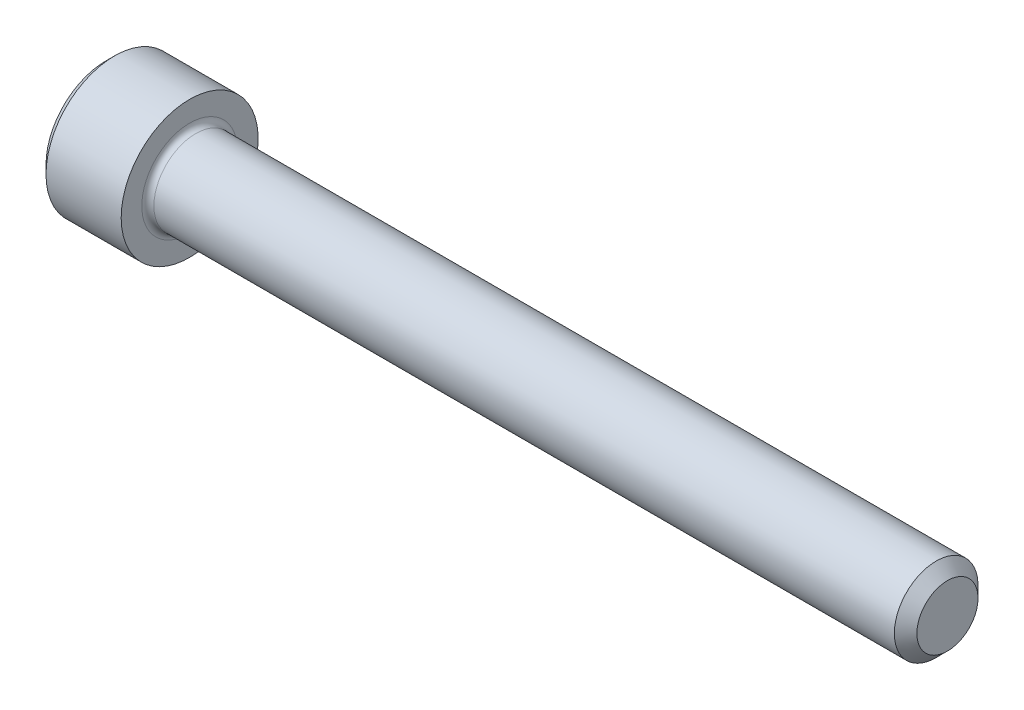
from build123d import *

# Parameters (mm, degrees)
FILLET1_R   = 0.254
HEX_2_DEPTH = 1.6256


with BuildPart() as part:
    # BodySke → Base-Revolve (revolve)
    with BuildSketch(Plane.XY):
        Polygon((0, 0), (0, 2.5146), (0.3556, 2.8702), (3.5052, 2.8702), (3.5052, 1.7526), (34.78276, 1.7526), (35.2552, 1.28016), (35.2552, 0), align=None)
    revolve(axis=Axis((-31.75, 0, 0), (1, 0, 0)))

    # Fillet1
    fillet1_edges = [part.edges().sort_by_distance(p)[0] for p in [
        (3.5052, -1.7526, 0),
    ]]
    fillet(fillet1_edges, radius=FILLET1_R)

    # Sketch2 → Hex-PreBroach (revolve, cut)
    with BuildSketch(Plane.XY):
        Polygon((0, 1.3843), (1.6256, 1.3843), (2.424825978, 0), (0, 0), align=None)
    revolve(axis=Axis((0, 0, 0), (1, 0, 0)), mode=Mode.SUBTRACT)

    # Sketch3 → Hex 2 (cut)
    with BuildSketch(Plane(origin=(0, 0, 0), x_dir=(0, 0.500000000000001, 0.866025403784438), z_dir=(-1, 0, 0))):
        Polygon((0.799225978, 1.3843), (-0.799225978, 1.3843), (-1.598451955, 0), (-0.799225978, -1.3843), (0.799225978, -1.3843), (1.598451955, 0), align=None)
    extrude(amount=-HEX_2_DEPTH, mode=Mode.SUBTRACT)


solid = part.part
